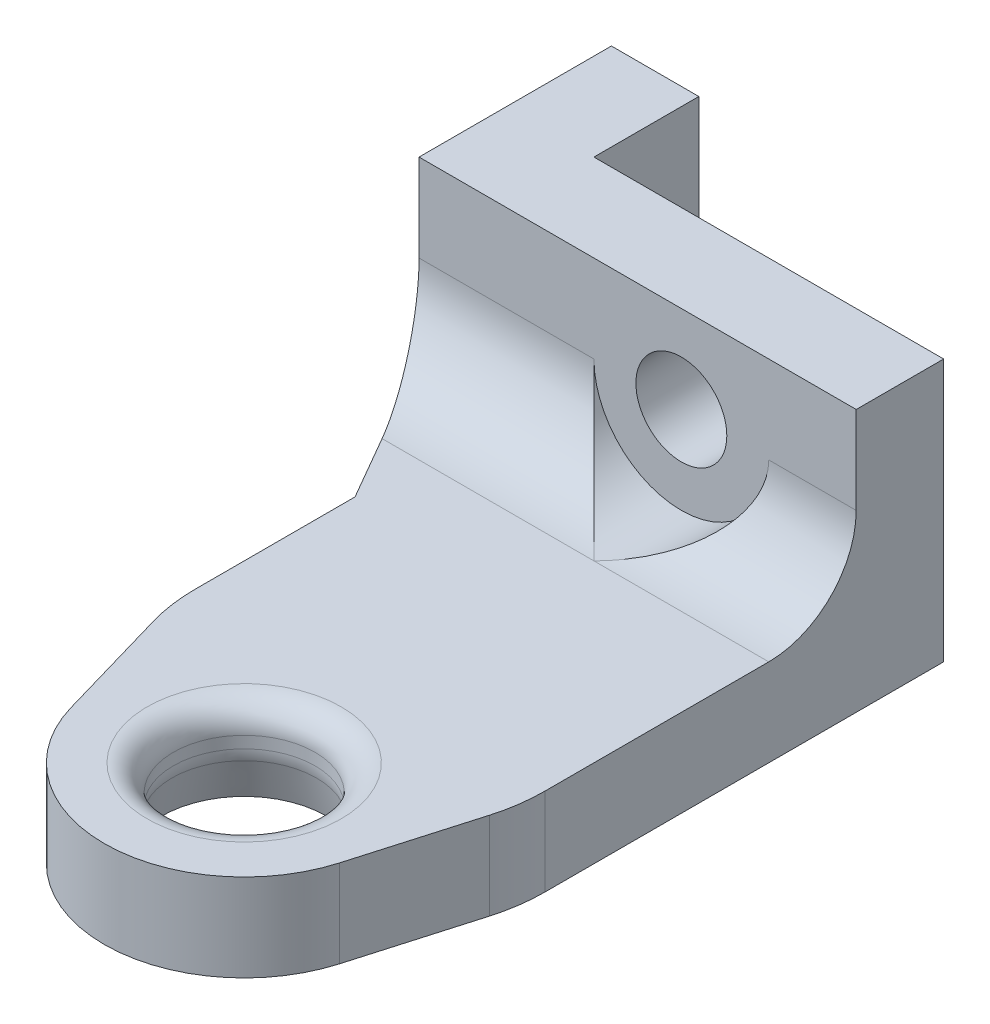
from build123d import *

# Parameters (mm, degrees)
SKETCH2_R           = 4.05
BOSS_EXTRUDE1_DEPTH = 5
FILLET1_R           = 10
SKETCH3_W           = 20
SKETCH3_H           = 15
BOSS_EXTRUDE2_DEPTH = 5
SKETCH6_R           = 2.6
CUT_EXTRUDE1_DEPTH  = 38.603191354
SKETCH4_W           = 11
SKETCH4_H           = 15
BOSS_EXTRUDE3_DEPTH = 5
CHAMFER1_SIZE2      = 5
CHAMFER1_SIZE       = 8.660254038
FILLET2_R           = 5
SKETCH7_R           = 5
CUT_EXTRUDE3_DEPTH  = 40.230090492
CHAMFER2_SIZE       = 2.5
CHAMFER2_SIZE2      = 0.669872981
FILLET3_R           = 1.5
FILLET4_R           = 2.5
SKETCH9_W           = 0.542735043
SKETCH9_H           = 2.03525641
CUT_EXTRUDE5_DEPTH  = 0.4


# Some blends are built 0.0001 mm under size
with BuildPart() as part:
    # Sketch2 → Boss-Extrude1 (new body)
    with BuildSketch(Plane(origin=(0, 0, 0), x_dir=(1, 0, 0), z_dir=(0, 1, 0))):
        with BuildLine():
            Line((-7.684618874, -2.224102688), (-10, 5.775897312))
            Line((-10, 5.775897312), (-10, 30))
            Line((-10, 30), (10, 30))
            Line((10, 30), (10, 5.775897312))
            Line((10, 5.775897312), (7.684618874, -2.224102688))
            ThreePointArc((7.684618874, -2.224102688), (0, -8), (-7.684618874, -2.224102688))
        make_face()
        with Locations(Location((0, 0, 0), (0, 0, 270))):
            Circle(SKETCH2_R, mode=Mode.SUBTRACT)
    extrude(amount=BOSS_EXTRUDE1_DEPTH)

    # Fillet1
    fillet1_edges = [part.edges().sort_by_distance(p)[0] for p in [
        (-10, 2.5, -5.775897312),
        (10, 2.5, -5.775897312),
    ]]
    fillet(fillet1_edges, radius=FILLET1_R)

    # Sketch3 → Boss-Extrude2 (add)
    with BuildSketch(Plane(origin=(0, 0, -30), x_dir=(-1, 0, 0), z_dir=(0, 0, -1))):
        with Locations((0, 7.5)):
            Rectangle(SKETCH3_W, SKETCH3_H)
    extrude(amount=-BOSS_EXTRUDE2_DEPTH)

    # Sketch6 → Cut-Extrude1 (cut, through all)
    with BuildSketch(Plane.XY.offset(-25)):
        with Locations((0, 10)):
            Circle(SKETCH6_R)
    extrude(amount=-CUT_EXTRUDE1_DEPTH, mode=Mode.SUBTRACT)

    # Sketch4 → Boss-Extrude3 (add)
    with BuildSketch(Plane.ZY.offset(10)):
        with Locations((-30.5, 7.5)):
            Rectangle(SKETCH4_W, SKETCH4_H)
    extrude(amount=BOSS_EXTRUDE3_DEPTH)

    # Chamfer1
    chamfer1_edges = [part.edges().sort_by_distance(p)[0] for p in [
        (-10, 2.5, -25),
    ]]
    chamfer1_side = [part.faces().sort_by_distance(p)[0] for p in [
        (-10, 2.5, -24.9),
    ]]
    chamfer(chamfer1_edges, length=CHAMFER1_SIZE - 0.0001, length2=CHAMFER1_SIZE2 - 0.0001, reference=chamfer1_side[0])  # a hair under: the kernel refuses the full size

    # Fillet2
    # the kernel refuses this fillet: 5 mm, written as the material it adds along each edge
    with BuildSketch(Plane(origin=(10, 5, -25), x_dir=(0, 0, 1), z_dir=(-1, 0, 0))) as fillet2_piece_1_section:
        with BuildLine():
            CenterArc((FILLET2_R, FILLET2_R), FILLET2_R, 180, 90)
            Line((0, FILLET2_R), (0, 0))
            Line((0, 0), (FILLET2_R, 0))
        make_face()
    fillet2_piece_1 = extrude(amount=37.4999, mode=Mode.PRIVATE)
    fillet2_piece_1 = split(fillet2_piece_1, bisect_by=Plane(origin=(-11.31874523, 6.103581905, -18.623999011), z_dir=(0.8660272339345467, 0, -0.49999683007362955)), keep=Keep.TOP, mode=Mode.PRIVATE)
    fillet2_piece_1 = fillet2_piece_1 - Plane(origin=(0, 10, -23.876099695), x_dir=(1, 0, 0), z_dir=(0, 0, 1)) * Cylinder(2.6, 95, mode=Mode.PRIVATE)
    fillet2_piece_1 = split(fillet2_piece_1, bisect_by=Plane(origin=(-15, 6.103581905, -23.876099695), z_dir=(1, 0, 0)), keep=Keep.TOP, mode=Mode.PRIVATE)
    add(fillet2_piece_1)

    # Sketch7 → Cut-Extrude3 (cut, through all)
    with BuildSketch(Plane.XY.offset(-25)):
        with Locations((0, 10)):
            Circle(SKETCH7_R)
    extrude(amount=CUT_EXTRUDE3_DEPTH, mode=Mode.SUBTRACT)

    # Chamfer2
    chamfer2_edges = [part.edges().sort_by_distance(p)[0] for p in [
        (0, 0, -4.05),
    ]]
    chamfer2_side = [part.faces().sort_by_distance(p)[0] for p in [
        (0, 2.5, -4.05),
    ]]
    chamfer(chamfer2_edges, length=CHAMFER2_SIZE, length2=CHAMFER2_SIZE2, reference=chamfer2_side[0])

    # Fillet3
    fillet3_edges = [part.edges().sort_by_distance(p)[0] for p in [
        (0, 5, -4.05),
    ]]
    fillet(fillet3_edges, radius=FILLET3_R)

    # Fillet4
    fillet4_edges = [part.edges().sort_by_distance(p)[0] for p in [
        (0, 2.5, -4.05),
    ]]
    fillet(fillet4_edges, radius=FILLET4_R)

    # Sketch9 → Cut-Extrude5 (cut)
    # profile 1 of 6: a face of its own
    with BuildSketch(Plane.XZ):
        Polygon((-2.291666667, -27.744123932), (-2.291666667, -27.269230769), (2.457264957, -27.269230769), (2.457264957, -25.233974359), (3, -25.233974359), (3, -27.744123932), align=None)
    # profile 2 of 6: a face of its own
    with BuildSketch(Plane.XZ):
        Polygon((-2.291666667, -24.352029915), (-2.291666667, -23.877136752), (2.457264957, -23.877136752), (2.457264957, -21.841880342), (3, -21.841880342), (3, -24.352029915), align=None)
    # profile 3 of 6: a face of its own
    with BuildSketch(Plane.XZ):
        with BuildLine():
            Line((-2.291666667, -20.959935897), (-2.291666667, -19.900966546))
            add(Edge.make_bspline(
                [(-2.291666667, -19.900966546), (-2.291431435, -19.830298412), (-2.290979766, -19.694607765), (-2.288461291, -19.500217225), (-2.28124292, -19.323585781), (-2.275031133, -19.164805786), (-2.263704031, -19.023880153), (-2.252877814, -18.900376749), (-2.238705732, -18.794864396), (-2.225543962, -18.730992693), (-2.219584669, -18.702073317)],
                knots=[0, 0, 0, 0, 1.410062039, 2.707475311, 3.878576406, 4.937260626, 5.877586885, 6.699081471, 7.410979367, 8, 8, 8, 8], degree=3))
            add(Edge.make_bspline(
                [(-2.219584669, -18.702073317), (-2.210019176, -18.66335857), (-2.191092249, -18.586754967), (-2.151088227, -18.476460978), (-2.104792892, -18.371363552), (-2.050424199, -18.271889729), (-1.987548423, -18.178572907), (-1.917362949, -18.090319491), (-1.840009535, -18.007415956), (-1.754790866, -17.930944258), (-1.663522649, -17.861481107), (-1.566455374, -17.800551224), (-1.463990393, -17.749066592), (-1.355968109, -17.708664372), (-1.243581792, -17.67476247), (-1.12568437, -17.651984568), (-1.002669421, -17.63779616), (-0.918968364, -17.636394485), (-0.876527444, -17.635683761)],
                knots=[0, 0, 0, 0, 1.02737844, 2.032840108, 3.019645024, 3.985760442, 4.950801802, 5.916702504, 6.889791722, 7.870143693, 8.864820395, 9.842884691, 10.820524757, 11.815201459, 12.812418953, 13.84314332, 14.906358105, 16, 16, 16, 16], degree=3))
            add(Edge.make_bspline(
                [(-0.876527444, -17.635683761), (-0.806019607, -17.637904746), (-0.668440556, -17.642238463), (-0.46877708, -17.682644275), (-0.282526569, -17.748830204), (-0.109923533, -17.840033271), (0.045667562, -17.956177003), (0.182329322, -18.095763294), (0.296689666, -18.258870016), (0.375993311, -18.410709577), (0.426782589, -18.544836998), (0.462518513, -18.655256411), (0.490128865, -18.775705294), (0.514863826, -18.905029598), (0.533538412, -19.043767505), (0.547216001, -19.191586493), (0.555764384, -19.348591985), (0.557037415, -19.456449863), (0.557692308, -19.511935764)],
                knots=[0, 0, 0, 0, 1.260483769, 2.459530307, 3.627416485, 4.787058657, 5.939039949, 7.08810263, 8.267026773, 9.491475466, 10.141966685, 10.831826277, 11.566392101, 12.351337768, 13.187381173, 14.07005841, 15.007169909, 16, 16, 16, 16], degree=3))
            Line((0.557692308, -19.511935764), (3, -17.56784188))
            Line((3, -17.56784188), (3, -18.155098157))
            Line((3, -18.155098157), (0.557692308, -20.099192041))
            Line((0.557692308, -20.099192041), (0.557692308, -20.485042735))
            Line((0.557692308, -20.485042735), (3, -20.485042735))
            Line((3, -20.485042735), (3, -20.959935897))
            Line((3, -20.959935897), (-2.291666667, -20.959935897))
        make_face()
        with BuildLine():
            Line((-1.748931624, -20.485042735), (0.014957265, -20.485042735))
            Line((0.014957265, -20.485042735), (0.022377471, -19.516175881))
            add(Edge.make_bspline(
                [(0.022377471, -19.516175881), (0.022397495, -19.470939626), (0.022436307, -19.38325888), (0.016397941, -19.256409145), (0.009529412, -19.138298704), (-0.000979125, -19.029380854), (-0.014513976, -18.929601877), (-0.031470988, -18.839028209), (-0.051142008, -18.757457964), (-0.081903638, -18.662631567), (-0.128511472, -18.555491374), (-0.200901812, -18.441599052), (-0.28788413, -18.341667678), (-0.39021953, -18.260280996), (-0.500949552, -18.192092216), (-0.621208277, -18.146203879), (-0.747094629, -18.11562125), (-0.833588357, -18.112277751), (-0.877587473, -18.110576923)],
                knots=[0, 0, 0, 0, 1.146477201, 2.22219935, 3.21835465, 4.145220026, 4.995151787, 5.769831222, 6.480173269, 7.120302478, 8.295254187, 9.430763426, 10.528629691, 11.636497428, 12.733230534, 13.811001502, 14.886462612, 16, 16, 16, 16], degree=3))
            add(Edge.make_bspline(
                [(-0.877587473, -18.110576923), (-0.920138942, -18.112399661), (-1.004460427, -18.116011664), (-1.127967257, -18.145339444), (-1.244569168, -18.195478219), (-1.35441671, -18.261435999), (-1.45257154, -18.344213294), (-1.537466125, -18.439409669), (-1.606964031, -18.547006804), (-1.653154856, -18.646685192), (-1.680280691, -18.736493425), (-1.699996598, -18.814098038), (-1.713680172, -18.902214988), (-1.726641012, -19.000443547), (-1.737133161, -19.108971178), (-1.744370503, -19.228115966), (-1.748609016, -19.357139847), (-1.748821585, -19.44656397), (-1.748931624, -19.492855235)],
                knots=[0, 0, 0, 0, 1.100823979, 2.181431445, 3.263702604, 4.376021382, 5.48638238, 6.575013887, 7.666064109, 8.791843368, 9.405226397, 10.093019944, 10.863016055, 11.711746407, 12.658404307, 13.684961631, 14.801597923, 16, 16, 16, 16], degree=3))
            Line((-1.748931624, -19.492855235), (-1.748931624, -20.485042735))
        make_face(mode=Mode.SUBTRACT)
    # profile 4 of 6: a face of its own
    with BuildSketch(Plane.XZ):
        with Locations((0.96474359, -15.939636752)):
            Rectangle(SKETCH9_W, SKETCH9_H)
    # profile 5 of 6: a face of its own
    with BuildSketch(Plane.XZ):
        with BuildLine():
            add(Edge.make_bspline(
                [(0.356286725, -14.514957265), (0.271472818, -14.514461333), (0.10672058, -14.513497977), (-0.133346677, -14.50278096), (-0.358560447, -14.484977764), (-0.56893151, -14.460579592), (-0.764514182, -14.43088884), (-0.944785767, -14.391253509), (-1.110580689, -14.346179429), (-1.262439362, -14.293939293), (-1.40240851, -14.234993914), (-1.533073498, -14.170835783), (-1.654246443, -14.09892791), (-1.767826261, -14.023347679), (-1.872078268, -13.941152761), (-1.968203643, -13.854105571), (-2.055391743, -13.760465154), (-2.133702276, -13.661139735), (-2.202369187, -13.55680249), (-2.263225844, -13.450304564), (-2.313353149, -13.339743078), (-2.354358664, -13.22657351), (-2.387832412, -13.110557342), (-2.410825447, -12.991724193), (-2.425266903, -12.869798597), (-2.42664933, -12.787503934), (-2.427350427, -12.745768229)],
                knots=[0, 0, 0, 0, 1.646148282, 3.197666765, 4.66315463, 6.030252048, 7.307778049, 8.501004361, 9.610818041, 10.641065266, 11.615491391, 12.557119604, 13.464013759, 14.348536654, 15.203310953, 16.038349431, 16.863300206, 17.683791446, 18.490318933, 19.285717724, 20.06220424, 20.843281102, 21.620494212, 22.403315558, 23.190242141, 24, 24, 24, 24], degree=3))
            add(Edge.make_bspline(
                [(-2.427350427, -12.745768229), (-2.426766454, -12.703663227), (-2.425604553, -12.619889092), (-2.4092501, -12.496479642), (-2.388140934, -12.375219774), (-2.354285307, -12.257949239), (-2.313772659, -12.142450678), (-2.260316864, -12.031596308), (-2.202179536, -11.921472383), (-2.131256885, -11.817081686), (-2.052875685, -11.715305214), (-1.963892985, -11.619900398), (-1.866771391, -11.528428435), (-1.759344807, -11.444344186), (-1.6432604, -11.364043917), (-1.517545051, -11.290575907), (-1.38247736, -11.222412155), (-1.238683482, -11.158271365), (-1.08232246, -11.102181937), (-0.914369559, -11.052313953), (-0.733303883, -11.011438701), (-0.540134084, -10.977635587), (-0.333903201, -10.951397936), (-0.115029082, -10.932302617), (0.116625204, -10.9222124), (0.275009144, -10.92031255), (0.356286725, -10.919337607)],
                knots=[0, 0, 0, 0, 0.810910589, 1.61342667, 2.396193133, 3.181089899, 3.963115317, 4.752255436, 5.550715454, 6.36105385, 7.181178335, 8.024612154, 8.872680183, 9.750181803, 10.651284446, 11.591556747, 12.554036451, 13.566402641, 14.62422919, 15.753422176, 16.94128843, 18.199818041, 19.531985927, 20.947085226, 22.433341622, 24, 24, 24, 24], degree=3))
            add(Edge.make_bspline(
                [(0.356286725, -10.919337607), (0.437209068, -10.920333999), (0.595235899, -10.922279774), (0.825858718, -10.93208621), (1.043553058, -10.951864346), (1.248551014, -10.976243388), (1.44094763, -11.010424317), (1.620617541, -11.051609509), (1.78819686, -11.09853391), (1.942484903, -11.15548416), (2.086029255, -11.218132022), (2.220103801, -11.286222628), (2.345785951, -11.359276046), (2.462176548, -11.438371998), (2.56917194, -11.523839347), (2.666626644, -11.615247196), (2.756175312, -11.711485008), (2.835420039, -11.81385482), (2.906882659, -11.919217852), (2.967129759, -12.029352965), (3.019330335, -12.141441504), (3.062009122, -12.256602567), (3.095107019, -12.374658352), (3.117860021, -12.496001333), (3.133853634, -12.619906507), (3.135071606, -12.703669052), (3.135683761, -12.745768229)],
                knots=[0, 0, 0, 0, 1.561645053, 3.049612875, 4.452756685, 5.778837748, 7.032101753, 8.221335837, 9.334924186, 10.387562255, 11.392109817, 12.355697819, 13.287721948, 14.19548756, 15.068665045, 15.927346723, 16.771751757, 17.602390507, 18.423119567, 19.225778204, 20.022010933, 20.807278863, 21.593079439, 22.384715467, 23.188155646, 24, 24, 24, 24], degree=3))
            add(Edge.make_bspline(
                [(3.135683761, -12.745768229), (3.134978676, -12.787503021), (3.133588386, -12.869795883), (3.11920453, -12.991734669), (3.096079185, -13.110090267), (3.063699322, -13.225446721), (3.024064974, -13.338395839), (2.972427903, -13.447398626), (2.912958363, -13.553666653), (2.845232615, -13.656917962), (2.767636587, -13.75520641), (2.681824031, -13.849107866), (2.585594425, -13.936176522), (2.4804628, -14.017658736), (2.366713996, -14.094037986), (2.244271675, -14.16532448), (2.112926767, -14.230828055), (1.971851431, -14.290780506), (1.818914934, -14.343935042), (1.652697385, -14.390705844), (1.471510509, -14.428060247), (1.276274226, -14.459723878), (1.066591834, -14.48509636), (0.842387469, -14.502773567), (0.604086879, -14.513489841), (0.440394086, -14.514459198), (0.356286725, -14.514957265)],
                knots=[0, 0, 0, 0, 0.810927267, 1.598990287, 2.382942141, 3.152806972, 3.926217614, 4.706701772, 5.493896336, 6.292070767, 7.104102563, 7.925577746, 8.761822141, 9.623241997, 10.509042271, 11.423174113, 12.375371989, 13.360203808, 14.400680605, 15.520553799, 16.714061498, 17.994519714, 19.364400916, 20.818312473, 22.365209998, 24, 24, 24, 24], degree=3))
        make_face()
        with BuildLine():
            add(Edge.make_bspline(
                [(0.354166667, -14.040064103), (0.424845964, -14.03987955), (0.562020603, -14.03952137), (0.761006658, -14.030434962), (0.946912785, -14.017787609), (1.119666427, -14.001876511), (1.278663815, -13.978047379), (1.424565959, -13.951011772), (1.557102796, -13.918584212), (1.677432541, -13.880027401), (1.787259112, -13.83610744), (1.889509777, -13.788238756), (1.985396395, -13.736358494), (2.074686333, -13.679403222), (2.156288119, -13.616246894), (2.232270172, -13.549817446), (2.299989902, -13.477122266), (2.381222674, -13.376579412), (2.465160955, -13.243837394), (2.53825605, -13.076590438), (2.584191327, -12.904734406), (2.590032972, -12.788089084), (2.592948718, -12.729867788)],
                knots=[0, 0, 0, 0, 1.459098681, 2.831824031, 4.11146945, 5.306290378, 6.412266529, 7.42953815, 8.369053297, 9.227277979, 10.03601793, 10.809473603, 11.557037441, 12.285528272, 12.993193355, 13.685654407, 14.36688038, 15.041354379, 16.352855396, 17.594313975, 18.799247529, 20, 20, 20, 20], degree=3))
            add(Edge.make_bspline(
                [(2.592948718, -12.729867788), (2.590395634, -12.671309472), (2.585298522, -12.554400558), (2.540812942, -12.382702393), (2.468493515, -12.217396038), (2.385870284, -12.086938016), (2.306681713, -11.987963288), (2.239243685, -11.917023364), (2.163710982, -11.851919289), (2.082221544, -11.790169506), (1.993211631, -11.733535078), (1.897111163, -11.682034821), (1.793652737, -11.63503977), (1.721429445, -11.608265378), (1.684503539, -11.594576322)],
                knots=[0, 0, 0, 0, 1.353621445, 2.702441307, 4.075953605, 5.516772412, 6.261413105, 7.007624062, 7.778524365, 8.566925914, 9.372323995, 10.217594641, 11.088702136, 12, 12, 12, 12], degree=3))
            add(Edge.make_bspline(
                [(1.684503539, -11.594576322), (1.637287147, -11.578623054), (1.541417623, -11.546231078), (1.392701149, -11.504484705), (1.236668398, -11.471607733), (1.074251853, -11.442029787), (0.904253734, -11.421841238), (0.727200034, -11.405591568), (0.54295726, -11.396020172), (0.417779119, -11.394833704), (0.354166667, -11.394230769)],
                knots=[0, 0, 0, 0, 0.884706709, 1.796334032, 2.740027952, 3.714592787, 4.726048262, 5.777819803, 6.87074269, 8, 8, 8, 8], degree=3))
            add(Edge.make_bspline(
                [(0.354166667, -11.394230769), (0.290564503, -11.395062603), (0.166145076, -11.396689848), (-0.016066935, -11.402909805), (-0.189131289, -11.418971638), (-0.35379355, -11.436810783), (-0.509142225, -11.463113721), (-0.656477793, -11.49147375), (-0.793975029, -11.529575541), (-0.92378639, -11.570275822), (-1.044437895, -11.616857705), (-1.156489101, -11.668136796), (-1.260491283, -11.722894592), (-1.356123103, -11.782397469), (-1.443939269, -11.845816611), (-1.521919136, -11.915425873), (-1.593855995, -11.98680455), (-1.674502526, -12.088320075), (-1.757380149, -12.220141073), (-1.831574439, -12.385302392), (-1.875484622, -12.556237238), (-1.881573992, -12.67203267), (-1.884615385, -12.729867788)],
                knots=[0, 0, 0, 0, 1.313483664, 2.569454835, 3.763100662, 4.901599063, 5.988328865, 7.015709358, 7.99797933, 8.932480776, 9.824041341, 10.666387587, 11.475829342, 12.24921787, 12.990555181, 13.709176526, 14.405678811, 15.080244297, 16.38186033, 17.610124501, 18.806354173, 20, 20, 20, 20], degree=3))
            add(Edge.make_bspline(
                [(-1.884615385, -12.729867788), (-1.881566425, -12.788403408), (-1.875462951, -12.905581284), (-1.83177751, -13.078341554), (-1.757597227, -13.244618638), (-1.674662199, -13.376874333), (-1.594165202, -13.477156615), (-1.52565299, -13.548319274), (-1.451485734, -13.615670008), (-1.369160047, -13.67719091), (-1.280184723, -13.733808454), (-1.185538085, -13.787693702), (-1.083096367, -13.834922256), (-0.973355914, -13.878983219), (-0.85301955, -13.917604343), (-0.720003149, -13.949661382), (-0.573752581, -13.978845526), (-0.413593467, -13.999862866), (-0.240802954, -14.01837003), (-0.054421404, -14.030296117), (0.145247951, -14.039562995), (0.283132309, -14.039893721), (0.354166667, -14.040064103)],
                knots=[0, 0, 0, 0, 1.207546505, 2.417292871, 3.651582144, 4.952510111, 5.626719005, 6.30238548, 6.989136872, 7.692112372, 8.420316868, 9.164734959, 9.937886623, 10.746308695, 11.604196049, 12.543341915, 13.568754172, 14.680483261, 15.875568977, 17.154711427, 18.534182925, 20, 20, 20, 20], degree=3))
        make_face(mode=Mode.SUBTRACT)
    # profile 6 of 6: a face of its own
    with BuildSketch(Plane.XZ):
        with BuildLine():
            Line((-1.070512821, -9.766025641), (-1.070512821, -10.240918803))
            add(Edge.make_bspline(
                [(-1.070512821, -10.240918803), (-1.123780981, -10.228053173), (-1.227915877, -10.202901919), (-1.376698283, -10.150442492), (-1.517492179, -10.093293618), (-1.647661243, -10.024669615), (-1.769821489, -9.949817093), (-1.881202189, -9.864057741), (-1.984636077, -9.77134816), (-2.07642871, -9.668803296), (-2.1595498, -9.561263534), (-2.230420423, -9.447213573), (-2.291386702, -9.328948008), (-2.341612528, -9.205647438), (-2.379448737, -9.076944773), (-2.406900098, -8.944003557), (-2.424727139, -8.806475408), (-2.426466984, -8.713118932), (-2.427350427, -8.665715144)],
                knots=[0, 0, 0, 0, 1.162005537, 2.271625781, 3.343758855, 4.383309926, 5.390229558, 6.379919256, 7.361854164, 8.333198761, 9.295911338, 10.242430842, 11.177959212, 12.116337295, 13.062827104, 14.020064771, 14.994644689, 16, 16, 16, 16], degree=3))
            add(Edge.make_bspline(
                [(-2.427350427, -8.665715144), (-2.425265163, -8.596647189), (-2.421140119, -8.460017851), (-2.383471864, -8.259292768), (-2.323864818, -8.065728411), (-2.241505731, -7.881443476), (-2.139924912, -7.710267989), (-2.019025846, -7.557964469), (-1.881141187, -7.426597315), (-1.728843144, -7.316387959), (-1.566078266, -7.230095996), (-1.398558981, -7.166465407), (-1.226682667, -7.127727866), (-1.110632971, -7.1227075), (-1.052492321, -7.120192308)],
                knots=[0, 0, 0, 0, 1.083050992, 2.142477498, 3.193116406, 4.255571735, 5.30263384, 6.308962982, 7.297363603, 8.282367274, 9.249857812, 10.179914175, 11.08814088, 12, 12, 12, 12], degree=3))
            add(Edge.make_bspline(
                [(-1.052492321, -7.120192308), (-0.996541572, -7.121951547), (-0.887054638, -7.125394104), (-0.727213803, -7.154624825), (-0.576565193, -7.203816556), (-0.434474627, -7.271957745), (-0.301843024, -7.360164613), (-0.178371975, -7.467014999), (-0.063513843, -7.593263071), (0.002283456, -7.688934799), (0.036157853, -7.738189436)],
                knots=[0, 0, 0, 0, 1.024540389, 2.004866551, 2.965041327, 3.920577974, 4.882998113, 5.874504559, 6.905732034, 8, 8, 8, 8], degree=3))
            add(Edge.make_bspline(
                [(0.036157853, -7.738189436), (0.063240599, -7.681826819), (0.116986313, -7.569975194), (0.224064639, -7.419054711), (0.344661412, -7.279961761), (0.439824257, -7.203303983), (0.487730369, -7.164713542)],
                knots=[0, 0, 0, 0, 1.015663554, 2.015584519, 3.001021554, 4, 4, 4, 4], degree=3))
            add(Edge.make_bspline(
                [(0.487730369, -7.164713542), (0.522591493, -7.139251036), (0.591742867, -7.088742991), (0.702922939, -7.026398791), (0.81533531, -6.969839773), (0.931992983, -6.925767417), (1.051543849, -6.891637881), (1.174193186, -6.867241737), (1.300041149, -6.85208619), (1.385180256, -6.849915772), (1.427976429, -6.848824786)],
                knots=[0, 0, 0, 0, 1.025084078, 2.033381695, 3.024893161, 4.013698104, 4.991890475, 5.976764909, 6.982997093, 8, 8, 8, 8], degree=3))
            add(Edge.make_bspline(
                [(1.427976429, -6.848824786), (1.502074081, -6.851538311), (1.64992068, -6.85695259), (1.868358382, -6.905333837), (2.081855738, -6.9803672), (2.286161559, -7.086803089), (2.477133509, -7.217105299), (2.649264044, -7.370411578), (2.794901178, -7.548913627), (2.918059068, -7.746142222), (3.015590354, -7.960740398), (3.08588736, -8.189332755), (3.128051444, -8.4305964), (3.13311069, -8.595584547), (3.135683761, -8.679495526)],
                knots=[0, 0, 0, 0, 0.955697303, 1.906897079, 2.875188111, 3.870982192, 4.871999088, 5.854111427, 6.836107184, 7.836239895, 8.848948182, 9.870701427, 10.917064451, 12, 12, 12, 12], degree=3))
            add(Edge.make_bspline(
                [(3.135683761, -8.679495526), (3.134359656, -8.736066383), (3.131754259, -8.847378966), (3.114260381, -9.011083543), (3.081440588, -9.167016085), (3.040165155, -9.316690757), (2.983097246, -9.457848606), (2.915061725, -9.592520055), (2.834313912, -9.720114792), (2.740718012, -9.839875075), (2.635951399, -9.951672954), (2.518273604, -10.052660189), (2.389880905, -10.143954098), (2.249618388, -10.22497461), (2.097878908, -10.296062709), (1.934054417, -10.355688574), (1.759414956, -10.407749319), (1.637745705, -10.432001373), (1.575320513, -10.444444444)],
                knots=[0, 0, 0, 0, 1.048603596, 2.063302207, 3.045874044, 3.999447474, 4.937100059, 5.862643889, 6.7929026, 7.7308982, 8.676022965, 9.627908155, 10.600123445, 11.591992905, 12.626222643, 13.701663232, 14.820785756, 16, 16, 16, 16], degree=3))
            Line((1.575320513, -10.444444444), (1.575320513, -9.969551282))
            add(Edge.make_bspline(
                [(1.575320513, -9.969551282), (1.616064854, -9.957178925), (1.695316138, -9.933113615), (1.809374695, -9.892149617), (1.913935085, -9.845479729), (2.009764329, -9.79541367), (2.097806175, -9.742831972), (2.175732573, -9.683996312), (2.246966271, -9.62326439), (2.287099197, -9.577484891), (2.306740785, -9.555079794)],
                knots=[0, 0, 0, 0, 1.198163088, 2.33053128, 3.407730985, 4.417276592, 5.372219308, 6.28897303, 7.162600585, 8, 8, 8, 8], degree=3))
            add(Edge.make_bspline(
                [(2.306740785, -9.555079794), (2.329573728, -9.525448328), (2.375169134, -9.46627686), (2.43352129, -9.369915033), (2.48346934, -9.268217336), (2.524069208, -9.160335682), (2.554544934, -9.046255599), (2.576479927, -8.926439844), (2.590960431, -8.800691829), (2.592276289, -8.714871266), (2.592948718, -8.671015291)],
                knots=[0, 0, 0, 0, 0.946083416, 1.889246487, 2.84504177, 3.809995578, 4.801312957, 5.829064617, 6.89060985, 8, 8, 8, 8], degree=3))
            add(Edge.make_bspline(
                [(2.592948718, -8.671015291), (2.592017528, -8.621495115), (2.590196666, -8.524662684), (2.573451252, -8.383367837), (2.549063603, -8.248948244), (2.511397546, -8.12289632), (2.46485983, -8.00356091), (2.406427122, -7.892614845), (2.337870221, -7.788601684), (2.259947922, -7.692853655), (2.174643995, -7.606757471), (2.085421852, -7.530951302), (1.992657681, -7.466506873), (1.895838141, -7.414522178), (1.795364164, -7.373473131), (1.690953791, -7.345528292), (1.583461495, -7.326098026), (1.510392697, -7.324515648), (1.473557692, -7.323717949)],
                knots=[0, 0, 0, 0, 1.217147791, 2.380027433, 3.494444702, 4.572153297, 5.609568379, 6.639424714, 7.649109417, 8.668170816, 9.669597737, 10.625200337, 11.543417969, 12.441394052, 13.322311151, 14.205496177, 15.095365482, 16, 16, 16, 16], degree=3))
            add(Edge.make_bspline(
                [(1.473557692, -7.323717949), (1.424255607, -7.326036488), (1.325896757, -7.330662028), (1.181133668, -7.365829458), (1.041605143, -7.424195606), (0.909118325, -7.50430425), (0.787825439, -7.604205803), (0.678829463, -7.719177033), (0.588976746, -7.852345748), (0.526839453, -7.974820393), (0.484452258, -8.083325322), (0.456216973, -8.176178862), (0.43230839, -8.280132503), (0.410064788, -8.393927992), (0.391133717, -8.518423112), (0.375346681, -8.65348222), (0.362714656, -8.799132719), (0.357073596, -8.89996341), (0.354166667, -8.951923077)],
                knots=[0, 0, 0, 0, 1.070505987, 2.135685285, 3.216438728, 4.346150463, 5.486482244, 6.621737109, 7.7759408, 8.963942283, 9.59839197, 10.305095457, 11.070459627, 11.915156775, 12.823989992, 13.805807174, 14.869297358, 16, 16, 16, 16], degree=3))
            Line((0.354166667, -8.951923077), (-0.188568376, -8.951923077))
            add(Edge.make_bspline(
                [(-0.188568376, -8.951923077), (-0.18983946, -8.886479497), (-0.19232833, -8.758336426), (-0.216390165, -8.570656535), (-0.255018872, -8.391951453), (-0.310212625, -8.224790111), (-0.375224199, -8.072722743), (-0.450343279, -7.940262145), (-0.535365946, -7.830895395), (-0.628664348, -7.743479904), (-0.728184159, -7.677037991), (-0.832545064, -7.629254887), (-0.942160786, -7.600776116), (-1.016996529, -7.596989031), (-1.05461238, -7.59508547)],
                knots=[0, 0, 0, 0, 1.322091412, 2.58874672, 3.817242262, 5.011895168, 6.140903042, 7.155122731, 8.080855046, 8.929742606, 9.727943956, 10.488587771, 11.240295418, 12, 12, 12, 12], degree=3))
            add(Edge.make_bspline(
                [(-1.05461238, -7.59508547), (-1.082251188, -7.595698308), (-1.137237286, -7.59691752), (-1.217822782, -7.612904465), (-1.295941242, -7.635823444), (-1.370701985, -7.669099047), (-1.442258017, -7.712212737), (-1.511394306, -7.76421632), (-1.577217513, -7.826591914), (-1.640067225, -7.896453256), (-1.697243068, -7.973812555), (-1.747281393, -8.056865283), (-1.78972934, -8.14527467), (-1.824848683, -8.238474394), (-1.851237538, -8.336898774), (-1.870192757, -8.440049112), (-1.882041927, -8.548132159), (-1.88374807, -8.621870307), (-1.884615385, -8.659354968)],
                knots=[0, 0, 0, 0, 0.884325644, 1.759323928, 2.622595547, 3.489424008, 4.37295195, 5.294616785, 6.255907374, 7.274251867, 8.302369084, 9.333474657, 10.37669385, 11.44084034, 12.520297356, 13.637342342, 14.798947025, 16, 16, 16, 16], degree=3))
            add(Edge.make_bspline(
                [(-1.884615385, -8.659354968), (-1.882511778, -8.719606895), (-1.878402944, -8.837292921), (-1.842415055, -9.006951188), (-1.78499581, -9.164672086), (-1.716456602, -9.285229356), (-1.648798208, -9.3742542), (-1.589709362, -9.437870523), (-1.524043069, -9.5003432), (-1.447754811, -9.557562259), (-1.366010973, -9.615428866), (-1.274656121, -9.668110525), (-1.176073287, -9.719303155), (-1.106381078, -9.750149867), (-1.070512821, -9.766025641)],
                knots=[0, 0, 0, 0, 1.472543308, 2.876219568, 4.221790263, 5.565193594, 6.249813518, 6.953379497, 7.687249741, 8.463570142, 9.283606569, 10.136032583, 11.040678096, 12, 12, 12, 12], degree=3))
        make_face()
    extrude(amount=-CUT_EXTRUDE5_DEPTH, mode=Mode.SUBTRACT)


solid = part.part
